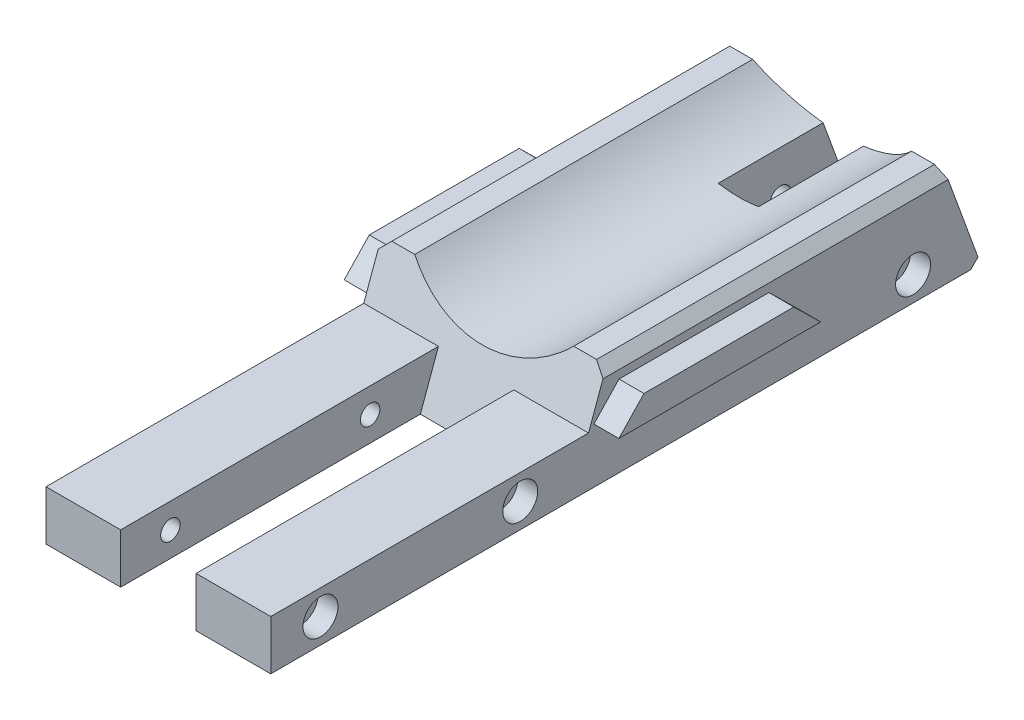
from build123d import *

# Parameters (mm, degrees)
SKETCH_1_W               = 63.621503831
SKETCH_1_H               = 9.95
EXTRUDE_1_DEPTH          = 22.5
CUT_EXTRUDE_START        = -7.55
CUT_EXTRUDE_1_DEPTH      = 15.1
CUT_EXTRUDE_2_DEPTH      = 145.249434495
CUT_EXTRUDE_2_DEPTH_BACK = 145.249434495
SKETCH_2_R               = 1.95
EXTRUDE_3_DEPTH          = 27.5
CUT_EXTRUDE_6_DEPTH      = 4.05
SKETCH_3_R               = 22.6
CUT_EXTRUDE_3_DEPTH      = 146.113401697
CUT_EXTRUDE_7_DEPTH      = 146.113401697
CUT_EXTRUDE_7_DEPTH_BACK = 146.113401697
SKETCH_10_R              = 2.1
SKETCH_11_W              = 39.483635772
SKETCH_11_H              = 6.923947262
CUT_EXTRUDE_8_DEPTH      = 5
CHAMFER_1_SIZE           = 2
SKETCH_4_R               = 3.5
CUT_EXTRUDE_4_DEPTH      = 4
SKETCH_12_R              = 3
CUT_EXTRUDE_9_DEPTH      = 3.1
CHAMFER_2_SIZE           = 2
CHAMFER_2_SIZE2          = 1.560412017
CHAMFER_2_EDGE_2_SIZE    = 2
CHAMFER_2_EDGE_2_SIZE2   = 1.560412017
SKETCH_13_R              = 1.925
CUT_EXTRUDE_10_DEPTH     = 5


# Read off the part's stored shape, not the designer's step: 컷-돌출1
with BuildPart() as part:
    # 스케치1 → 보스-돌출1 (new, symmetric)
    with BuildSketch(Plane(origin=(0, 0, 0), x_dir=(0, 0, -1), z_dir=(1, 0, 0))):
        with Locations((31.810751916, -4.975)):
            Rectangle(SKETCH_1_W, SKETCH_1_H)
        Polygon((142.136015324, -9.95), (63.621503831, -9.95), (63.621503831, 0), (67.243007662, 9.95), (134.893007662, 9.95), align=None)
        Polygon((63.621503831, -9.95), (63.621503831, 0), (60, -9.95), align=None)
    extrude(amount=EXTRUDE_1_DEPTH, both=True)

    # 컷-돌출1 outline → 컷-돌출1 (cut)
    with BuildSketch(Plane(origin=(0, 0, 0), x_dir=(0, 0, -1), z_dir=(1, 0, 0)).offset(CUT_EXTRUDE_START)):
        Polygon((60, -9.95), (63.621503831, 0), (0, 0), (0, -9.95), align=None)
    extrude(amount=CUT_EXTRUDE_1_DEPTH, mode=Mode.SUBTRACT)

    # 스케치2 → 컷-돌출2 (cut, two sides: drawn at the far end of the back side and taken through both)
    with BuildSketch(Plane(origin=(0, 0, 0), x_dir=(0, 0, -1), z_dir=(1, 0, 0)).offset(-CUT_EXTRUDE_2_DEPTH_BACK)):
        with Locations((9.95, -5)):
            Circle(SKETCH_2_R)
        with Locations((49.95, -5)):
            Circle(SKETCH_2_R)
    extrude(amount=CUT_EXTRUDE_2_DEPTH + CUT_EXTRUDE_2_DEPTH_BACK, mode=Mode.SUBTRACT)

    # 스케치6 → 보스-돌출3 (add, symmetric)
    with BuildSketch(Plane(origin=(0, 0, 0), x_dir=(0, 0, -1), z_dir=(1, 0, 0))):
        Polygon((64.701480994, 1.014614629), (69.728626839, 6.30205348), (99.728626839, 6.30205348), (105.104415209, 1.014614629), align=None)
    extrude(amount=EXTRUDE_3_DEPTH, both=True)

    # 스케치9 → 컷-돌출6 (cut, symmetric)
    with BuildSketch(Plane(origin=(0, 0, 0), x_dir=(0, 0, -1), z_dir=(1, 0, 0))):
        Polygon((139.292204442, 9.95), (148.391731499, -9.95), (117.656886036, -9.95), (115.43958996, 9.95), align=None)
    extrude(amount=CUT_EXTRUDE_6_DEPTH, both=True, mode=Mode.SUBTRACT)

    # 스케치3 → 컷-돌출3 (cut, through all)
    with BuildSketch(Plane.XY):
        with Locations((0, 26)):
            Circle(SKETCH_3_R)
    extrude(amount=-CUT_EXTRUDE_3_DEPTH, mode=Mode.SUBTRACT)

    # 스케치10 → 컷-돌출7 (cut, two sides: drawn at the far end of the back side and taken through both)
    with BuildSketch(Plane(origin=(0, 0, 0), x_dir=(0, 0, -1), z_dir=(1, 0, 0)).offset(-CUT_EXTRUDE_7_DEPTH_BACK)):
        with Locations((128.602443504, -5)):
            Circle(SKETCH_10_R)
    extrude(amount=CUT_EXTRUDE_7_DEPTH + CUT_EXTRUDE_7_DEPTH_BACK, mode=Mode.SUBTRACT)

    # 스케치11 → 컷-돌출8 (cut, symmetric)
    with BuildSketch(Plane(origin=(0, 0, 0), x_dir=(0, 0, -1), z_dir=(1, 0, 0))):
        with Locations((129.741817886, -12.461973631)):
            Rectangle(SKETCH_11_W, SKETCH_11_H)
    extrude(amount=CUT_EXTRUDE_8_DEPTH, both=True, mode=Mode.SUBTRACT)

    # 모따기1
    chamfer_1_edges = [part.edges().sort_by_distance(p)[0] for p in [
        (22.5, 9.95, -101.068007662),
        (-22.5, 9.95, -101.068007662),
    ]]
    chamfer(chamfer_1_edges, length=CHAMFER_1_SIZE)

    # 스케치4 → 컷-돌출4 (cut)
    with BuildSketch(Plane(origin=(22.5, 0, 0), x_dir=(0, 0, -1), z_dir=(1, 0, 0))):
        with Locations((9.95, -5)):
            Circle(SKETCH_4_R)
        with Locations((49.95, -5)):
            Circle(SKETCH_4_R)
        with Locations((128.602443504, -5)):
            Circle(SKETCH_4_R)
    extrude(amount=-CUT_EXTRUDE_4_DEPTH, mode=Mode.SUBTRACT)

    # 스케치12 → 컷-돌출9 (cut)
    with BuildSketch(Plane(origin=(0, 44.517705875, -122.311391657), x_dir=(-1, 0, 0), z_dir=(0, 0.3420201433256732, -0.9396926207859068))):
        with Locations(Location((-17, -42, 0), (0, 0, 90))):
            Circle(SKETCH_12_R)
        with Locations(Location((17, -42, 0), (0, 0, 90))):
            Circle(SKETCH_12_R)
    extrude(amount=-CUT_EXTRUDE_9_DEPTH, mode=Mode.SUBTRACT)

    # 모따기2
    chamfer_2_edges = [part.edges().sort_by_distance(p)[0] for p in [
        (-13.75, -9.95, -142.136015324),
    ]]
    chamfer_2_side = [part.faces().sort_by_distance(p)[0] for p in [
        (0, -9.95, -74.847019357),
    ]]
    chamfer(chamfer_2_edges, length=CHAMFER_2_SIZE, length2=CHAMFER_2_SIZE2, reference=chamfer_2_side[0])

    # 모따기2 edge 2
    chamfer_2_edge_2_edges = [part.edges().sort_by_distance(p)[0] for p in [
        (13.75, -9.95, -142.136015324),
    ]]
    chamfer_2_edge_2_side = [part.faces().sort_by_distance(p)[0] for p in [
        (0, -9.95, -74.847019357),
    ]]
    chamfer(chamfer_2_edge_2_edges, length=CHAMFER_2_EDGE_2_SIZE, length2=CHAMFER_2_EDGE_2_SIZE2, reference=chamfer_2_edge_2_side[0])

    # 스케치13 → 컷-돌출10 (cut)
    with BuildSketch(Plane.XZ.offset(9.95)):
        with Locations(Location((12, -5, 0), (0, 0, 270))):
            Circle(SKETCH_13_R)
        with Locations(Location((12, -35, 0), (0, 0, 270))):
            Circle(SKETCH_13_R)
        with Locations(Location((12, -65, 0), (0, 0, 270))):
            Circle(SKETCH_13_R)
        with Locations(Location((-12, -65, 0), (0, 0, 90))):
            Circle(SKETCH_13_R)
        with Locations(Location((-12, -35, 0), (0, 0, 90))):
            Circle(SKETCH_13_R)
        with Locations(Location((-12, -5, 0), (0, 0, 90))):
            Circle(SKETCH_13_R)
        with Locations(Location((12, -95, 0), (0, 0, 270))):
            Circle(SKETCH_13_R)
        with Locations(Location((12, -125, 0), (0, 0, 270))):
            Circle(SKETCH_13_R)
        with Locations(Location((-12, -125, 0), (0, 0, 231.333825211))):
            Circle(SKETCH_13_R)
        with Locations(Location((-12, -95, 0), (0, 0, 90))):
            Circle(SKETCH_13_R)
    extrude(amount=-CUT_EXTRUDE_10_DEPTH, mode=Mode.SUBTRACT)


solid = part.part
